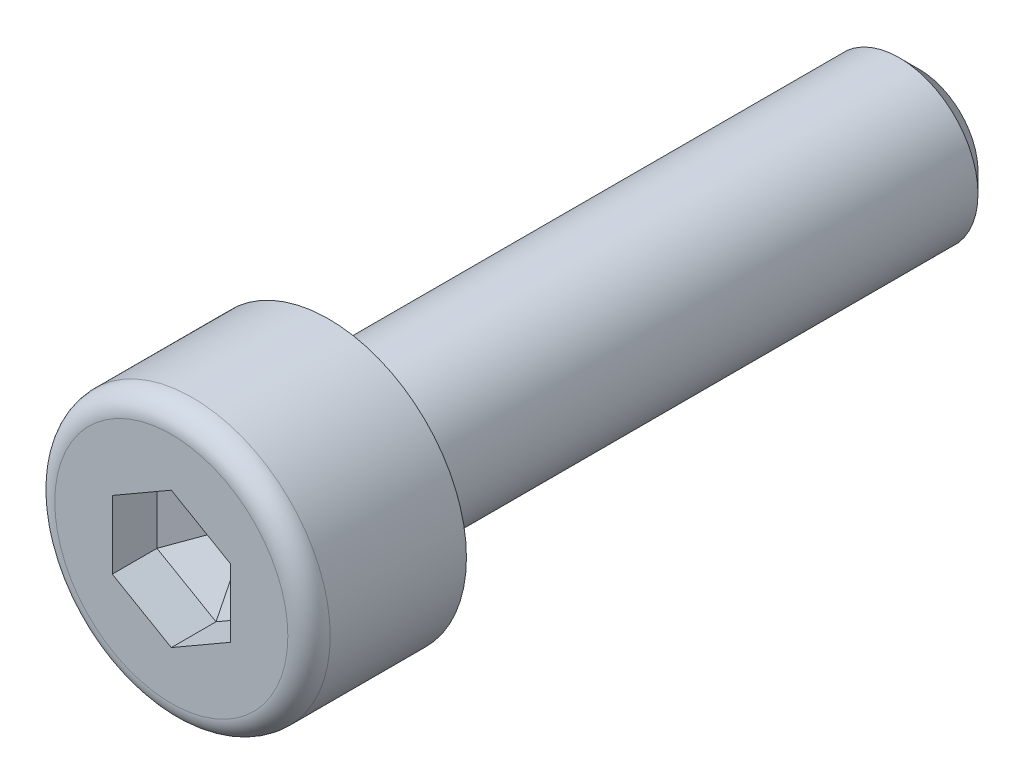
from build123d import *
from OCP.BRepFilletAPI import BRepFilletAPI_MakeChamfer

# Parameters (mm, degrees)
SKETCH_1_R          = 3.5
EXTRUDE_1_DEPTH     = 4
CUT_EXTRUDE_1_DEPTH = 2
SKETCH_3_R          = 2
EXTRUDE_2_DEPTH     = 15
CHAMFER_1_SIZE      = 0.5
FILLET_1_R          = 0.538461538
CHAMFER_2_SIZE      = 0.864553314
CHAMFER_2_SIZE2     = 1.497450266
FILLET_2_R          = 0.1


with BuildPart() as part:
    # 草图1 → 凸台-拉伸1 (new body)
    with BuildSketch(Plane.XY):
        Circle(SKETCH_1_R)
    extrude(amount=EXTRUDE_1_DEPTH)

    # 草图2 → 切除-拉伸1 (cut)
    with BuildSketch(Plane.XY.offset(4)):
        Polygon((1.5, 0.866025404), (0, 1.732050808), (-1.5, 0.866025404), (-1.5, -0.866025404), (0, -1.732050808), (1.5, -0.866025404), align=None)
    extrude(amount=-CUT_EXTRUDE_1_DEPTH, mode=Mode.SUBTRACT)

    # 草图3 → 凸台-拉伸2 (add)
    with BuildSketch(Plane(origin=(0, 0, 0), x_dir=(-1, 0, 0), z_dir=(0, 0, -1))):
        Circle(SKETCH_3_R)
    extrude(amount=EXTRUDE_2_DEPTH)

    # 倒角1
    chamfer_1_edges = [part.edges().sort_by_distance(p)[0] for p in [
        (2, 0, -15),
    ]]
    chamfer(chamfer_1_edges, length=CHAMFER_1_SIZE)

    # 圆角1
    fillet_1_edges = [part.edges().sort_by_distance(p)[0] for p in [
        (-3.5, 0, 4),
    ]]
    fillet(fillet_1_edges, radius=FILLET_1_R)

    # 倒角2: one chamfer whose edges measure the first distance from different faces: ONE call of the kernel's chamfer builder (chamfer() names one face for all edges)
    chamfer_2_edges_1 = [part.edges().sort_by_distance(p)[0] for p in [
        (-1.5, 0, 2),
    ]]
    chamfer_2_side_1 = [part.faces().sort_by_distance(p)[0] for p in [
        (-1.5, 0, 3),
    ]]
    chamfer_2_edges_2 = [part.edges().sort_by_distance(p)[0] for p in [
        (-0.75, 1.299038106, 2),
    ]]
    chamfer_2_side_2 = [part.faces().sort_by_distance(p)[0] for p in [
        (-0.75, 1.299038106, 3),
    ]]
    chamfer_2_edges_3 = [part.edges().sort_by_distance(p)[0] for p in [
        (0.75, 1.299038106, 2),
    ]]
    chamfer_2_side_3 = [part.faces().sort_by_distance(p)[0] for p in [
        (0.75, 1.299038106, 3),
    ]]
    chamfer_2_edges_4 = [part.edges().sort_by_distance(p)[0] for p in [
        (1.5, 0, 2),
    ]]
    chamfer_2_side_4 = [part.faces().sort_by_distance(p)[0] for p in [
        (1.5, 0, 3),
    ]]
    chamfer_2_edges_5 = [part.edges().sort_by_distance(p)[0] for p in [
        (-0.75, -1.299038106, 2),
    ]]
    chamfer_2_side_5 = [part.faces().sort_by_distance(p)[0] for p in [
        (-0.75, -1.299038106, 3),
    ]]
    chamfer_2_edges_6 = [part.edges().sort_by_distance(p)[0] for p in [
        (0.75, -1.299038106, 2),
    ]]
    chamfer_2_side_6 = [part.faces().sort_by_distance(p)[0] for p in [
        (0.75, -1.299038106, 3),
    ]]
    chamfer_2 = BRepFilletAPI_MakeChamfer(part.part.solid().wrapped)
    for e in chamfer_2_edges_1:
        chamfer_2.Add(CHAMFER_2_SIZE, CHAMFER_2_SIZE2, e.wrapped, chamfer_2_side_1[0].wrapped)  # the first distance lies on this face
    for e in chamfer_2_edges_2:
        chamfer_2.Add(CHAMFER_2_SIZE, CHAMFER_2_SIZE2, e.wrapped, chamfer_2_side_2[0].wrapped)  # the first distance lies on this face
    for e in chamfer_2_edges_3:
        chamfer_2.Add(CHAMFER_2_SIZE, CHAMFER_2_SIZE2, e.wrapped, chamfer_2_side_3[0].wrapped)  # the first distance lies on this face
    for e in chamfer_2_edges_4:
        chamfer_2.Add(CHAMFER_2_SIZE, CHAMFER_2_SIZE2, e.wrapped, chamfer_2_side_4[0].wrapped)  # the first distance lies on this face
    for e in chamfer_2_edges_5:
        chamfer_2.Add(CHAMFER_2_SIZE, CHAMFER_2_SIZE2, e.wrapped, chamfer_2_side_5[0].wrapped)  # the first distance lies on this face
    for e in chamfer_2_edges_6:
        chamfer_2.Add(CHAMFER_2_SIZE, CHAMFER_2_SIZE2, e.wrapped, chamfer_2_side_6[0].wrapped)  # the first distance lies on this face
    add(Compound.cast(chamfer_2.Shape()), mode=Mode.REPLACE)

    # 圆角2
    fillet_2_edges = [part.edges().sort_by_distance(p)[0] for p in [
        (2, 0, 0),
    ]]
    fillet(fillet_2_edges, radius=FILLET_2_R)


solid = part.part
